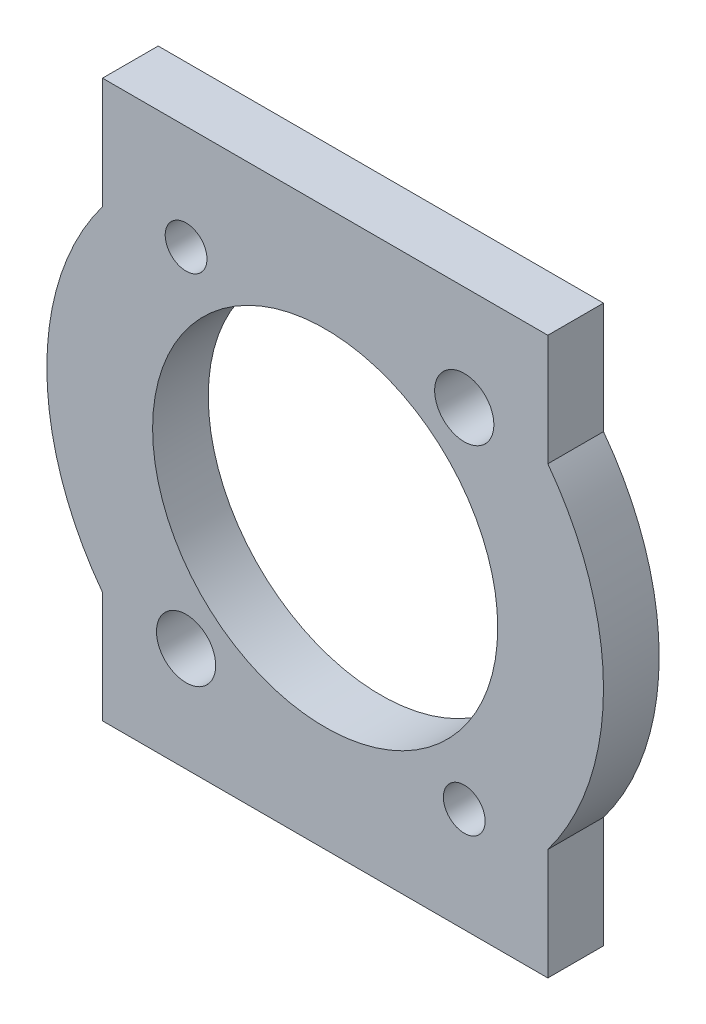
from build123d import *

# Parameters (mm, degrees)
SKETCH1_R           = 19.685
SKETCH1_R_2         = 2.38125
SKETCH1_R_3         = 3.3782
BOSS_EXTRUDE1_DEPTH = 6.35


with BuildPart() as part:
    # Sketch1 → Boss-Extrude1 (new body)
    with BuildSketch(Plane.XY):
        with BuildLine():
            Line((0, 0), (-50.8, 0))
            Line((-50.8, 0), (-50.8, 12.7))
            ThreePointArc((-50.8, 12.7), (-57.15, 31.75), (-50.8, 50.8))
            Line((-50.8, 50.8), (-50.8, 63.5))
            Line((-50.8, 63.5), (0, 63.5))
            Line((0, 63.5), (0, 50.8))
            ThreePointArc((0, 50.8), (6.35, 31.75), (0, 12.7))
            Line((0, 12.7), (0, 0))
        make_face()
        with Locations((-25.4, 31.75)):
            Circle(SKETCH1_R, mode=Mode.SUBTRACT)
        with Locations((-41.267254208, 51.58406776)):
            Circle(SKETCH1_R_2, mode=Mode.SUBTRACT)
        with Locations((-9.532745792, 51.58406776)):
            Circle(SKETCH1_R_3, mode=Mode.SUBTRACT)
        with Locations((-9.532745792, 11.91593224)):
            Circle(SKETCH1_R_2, mode=Mode.SUBTRACT)
        with Locations((-41.267254208, 11.91593224)):
            Circle(SKETCH1_R_3, mode=Mode.SUBTRACT)
    extrude(amount=BOSS_EXTRUDE1_DEPTH)


solid = part.part
